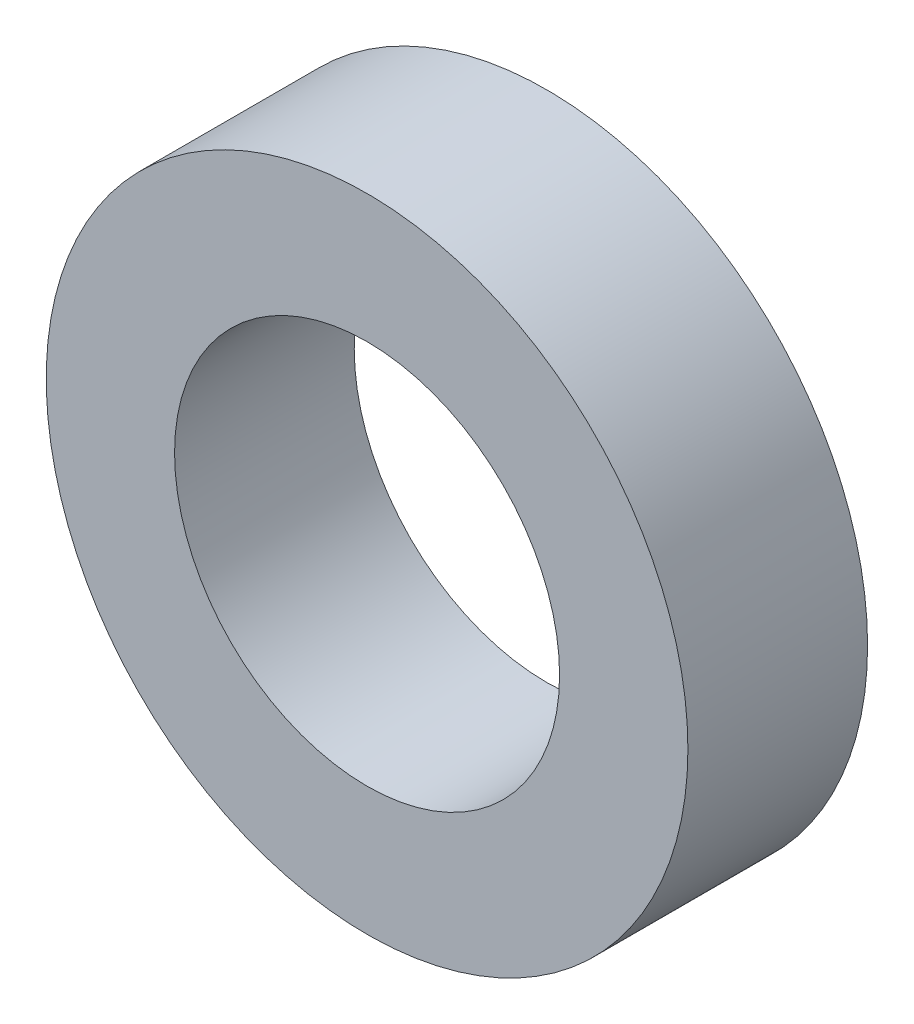
from build123d import *

# Parameters (mm, degrees)
SKETCH1_R           = 15.875
SKETCH1_R_2         = 9.525
BOSS_EXTRUDE1_DEPTH = 8.89


with BuildPart() as part:
    # Sketch1 → Boss-Extrude1 (new body)
    with BuildSketch(Plane.XY):
        Circle(SKETCH1_R)
        Circle(SKETCH1_R_2, mode=Mode.SUBTRACT)
    extrude(amount=BOSS_EXTRUDE1_DEPTH)


solid = part.part
